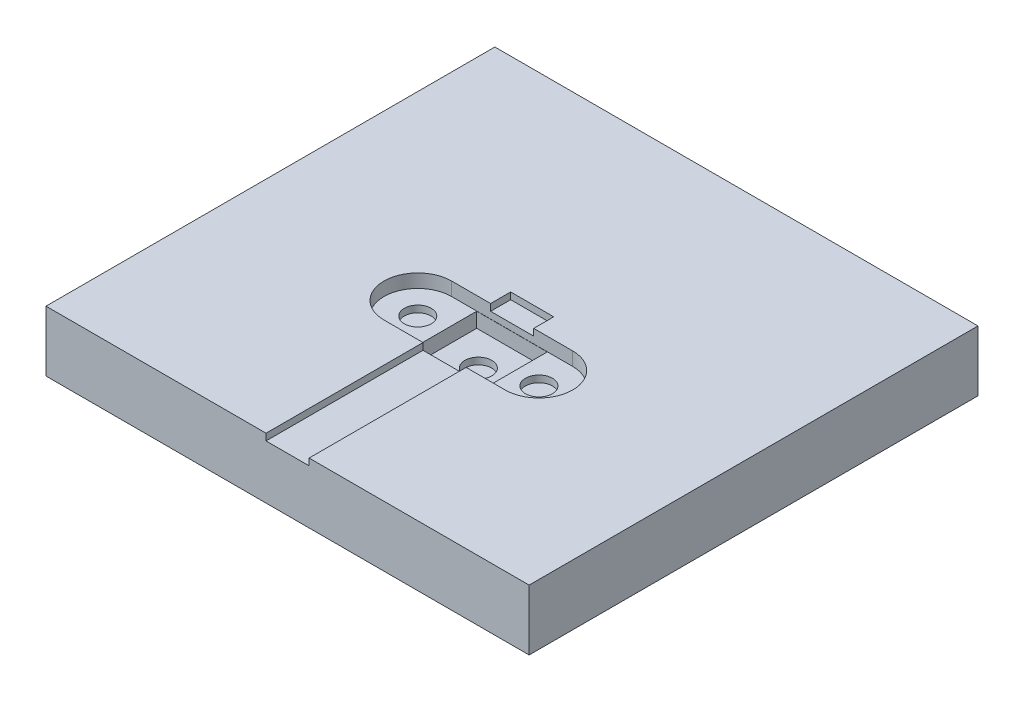
from build123d import *

# Parameters (mm, degrees)
CROQUIS1_W                = 71.796950719
CROQUIS1_H                = 66.705557785
SALIENTE_EXTRUIR1_DEPTH   = 10
CORTAR_EXTRUIR1_DEPTH     = 3
CROQUIS4_R                = 2
CORTAR_EXTRUIR3_DEPTH     = 4
CORTAR_EXTRUIR4_START     = -1
CORTAR_EXTRUIR4_OUTLINE_W = 71.796950719
CORTAR_EXTRUIR4_OUTLINE_H = 66.705557785
CORTAR_EXTRUIR4_DEPTH     = 1
CROQUIS6_W                = 10.482335709
CROQUIS6_H                = 10
CORTAR_EXTRUIR5_DEPTH     = 5.2
CROQUIS7_R                = 2
CORTAR_EXTRUIR6_DEPTH     = 6.2
CROQUIS8_W                = 6.4
CROQUIS8_H                = 36.352778893
CORTAR_EXTRUIR7_DEPTH     = 1


# Read off the part's stored shape, not the designer's step: Cortar-Extruir4
with BuildPart() as part:
    # Croquis1 → Saliente-Extruir1 (new body)
    with BuildSketch(Plane(origin=(0, 0, 0), x_dir=(1, 0, 0), z_dir=(0, 1, 0))):
        with Locations((42.262259736, 150.287845226)):
            Rectangle(CROQUIS1_W, CROQUIS1_H)
    extrude(amount=SALIENTE_EXTRUIR1_DEPTH)

    # Croquis3 → Cortar-Extruir1 (cut)
    with BuildSketch(Plane(origin=(0, 10, 0), x_dir=(1, 0, 0), z_dir=(0, 1, 0))):
        with BuildLine():
            Line((33.262259735, 150.310457053), (51.262259735, 150.310457053))
            ThreePointArc((51.262259735, 150.310457053), (56.284871563, 145.287845226), (51.262259735, 140.265233398))
            Line((51.262259735, 140.265233398), (33.262259735, 140.265233398))
            ThreePointArc((33.262259735, 140.265233398), (28.239647907, 145.287845226), (33.262259735, 150.310457053))
        make_face()
    extrude(amount=-CORTAR_EXTRUIR1_DEPTH, mode=Mode.SUBTRACT)

    # Croquis4 → Cortar-Extruir3 (cut)
    with BuildSketch(Plane(origin=(0, 10, 0), x_dir=(1, 0, 0), z_dir=(0, 1, 0))):
        with Locations(Location((51.262259735, 145.287845226, 0), (0, 0, 270))):
            Circle(CROQUIS4_R)
        with Locations(Location((33.262259735, 145.287845226, 0), (0, 0, 270))):
            Circle(CROQUIS4_R)
    extrude(amount=-CORTAR_EXTRUIR3_DEPTH, mode=Mode.SUBTRACT)

    # Cortar-Extruir4 outline → Cortar-Extruir4 (cut)
    with BuildSketch(Plane(origin=(0, 10, 0), x_dir=(1, 0, 0), z_dir=(0, 1, 0)).offset(CORTAR_EXTRUIR4_START)):
        with Locations((42.262259736, 150.287845226)):
            Rectangle(CORTAR_EXTRUIR4_OUTLINE_W, CORTAR_EXTRUIR4_OUTLINE_H)
        with BuildLine():
            ThreePointArc((33.262259735, 140.265233398), (28.239647907, 145.287845226), (33.262259735, 150.310457053))
            Line((33.262259735, 150.310457053), (51.262259735, 150.310457053))
            ThreePointArc((51.262259735, 150.310457053), (56.284871563, 145.287845226), (51.262259735, 140.265233398))
            Line((51.262259735, 140.265233398), (33.262259735, 140.265233398))
        make_face(mode=Mode.SUBTRACT)
    extrude(amount=CORTAR_EXTRUIR4_DEPTH, mode=Mode.SUBTRACT)

    # Croquis6 → Cortar-Extruir5 (cut)
    with BuildSketch(Plane(origin=(0, 10, 0), x_dir=(1, 0, 0), z_dir=(0, 1, 0))):
        with Locations((42.262259736, 145.287845226)):
            Rectangle(CROQUIS6_W, CROQUIS6_H)
    extrude(amount=-CORTAR_EXTRUIR5_DEPTH, mode=Mode.SUBTRACT)

    # Croquis7 → Cortar-Extruir6 (cut)
    with BuildSketch(Plane(origin=(0, 10, 0), x_dir=(1, 0, 0), z_dir=(0, 1, 0))):
        with Locations(Location((42.262259735, 145.287845226, 0), (0, 0, 270))):
            Circle(CROQUIS7_R)
    extrude(amount=-CORTAR_EXTRUIR6_DEPTH, mode=Mode.SUBTRACT)

    # Croquis8 → Cortar-Extruir7 (cut)
    with BuildSketch(Plane(origin=(0, 9, 0), x_dir=(1, 0, 0), z_dir=(0, 1, 0))):
        with Locations((42.262259735, 135.11145578)):
            Rectangle(CROQUIS8_W, CROQUIS8_H)
    extrude(amount=-CORTAR_EXTRUIR7_DEPTH, mode=Mode.SUBTRACT)


solid = part.part
